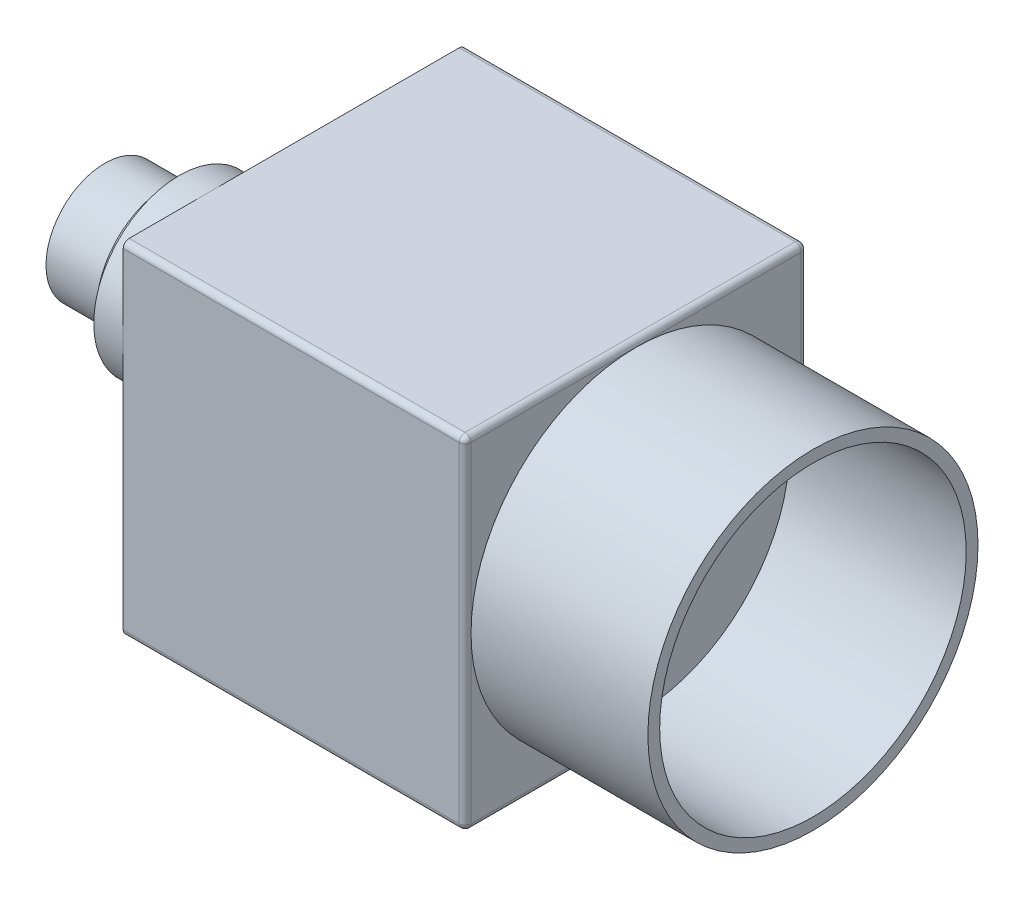
from build123d import *

# Parameters (mm, degrees)
SKETCH_1_W             = 29
SKETCH_1_H             = 29
EXTRUDE_1_DEPTH        = 29
SKETCH_3_W             = 22.7
SKETCH_3_H             = 9
EXTRUDE_3_DEPTH        = 1
SKETCH_4_R             = 1
SKETCH_4_W             = 14
SKETCH_4_H             = 3
SKETCH_4_W_2           = 13
SKETCH_4_H_2           = 2
EXTRUDE_4_DEPTH        = 1
SKETCH_5_R             = 7.25
EXTRUDE_5_DEPTH        = 2.5
SKETCH_6_R             = 6
EXTRUDE_6_DEPTH        = 1
SKETCH_7_R             = 5
EXTRUDE_7_DEPTH        = 5.3
SKETCH_8_R             = 14
SKETCH_8_R_2           = 13
EXTRUDE_8_DEPTH        = 15
HOLE_WIZARD_M3_1_D     = 2.5
HOLE_WIZARD_M3_1_DEPTH = 4.2
HOLE_WIZARD_M3_1_TIP   = 0.751075774
FILLET_1_R             = 0.5


with BuildPart() as part:
    # 草图1 → 凸台-拉伸1 (new body)
    with BuildSketch(Plane(origin=(0, 0, 0), x_dir=(0, 0, -1), z_dir=(1, 0, 0))):
        Rectangle(SKETCH_1_W, SKETCH_1_H)
    extrude(amount=EXTRUDE_1_DEPTH)

    # 草图3 → 凸台-拉伸3 (add)
    with BuildSketch(Plane.ZY):
        with Locations((0, -8.6)):
            Rectangle(SKETCH_3_W, SKETCH_3_H)
    extrude(amount=EXTRUDE_3_DEPTH)

    # 草图4 → 凸台-拉伸4 (add)
    # profile 1 of 3: a face of its own
    with BuildSketch(Plane.ZY.offset(1)):
        with Locations((-9, -8.6)):
            Circle(SKETCH_4_R)
    # profile 2 of 3: a face of its own
    with BuildSketch(Plane.ZY.offset(1)):
        with Locations((9, -8.6)):
            Circle(SKETCH_4_R)
    # profile 3 of 3: a face of its own
    with BuildSketch(Plane.ZY.offset(1)):
        with Locations((0, -8.6)):
            Rectangle(SKETCH_4_W, SKETCH_4_H)
        with Locations((0, -8.6)):
            Rectangle(SKETCH_4_W_2, SKETCH_4_H_2, mode=Mode.SUBTRACT)
    extrude(amount=EXTRUDE_4_DEPTH)

    # 草图5 → 凸台-拉伸5 (add)
    with BuildSketch(Plane.ZY):
        with Locations((7.25, 7.25)):
            Circle(SKETCH_5_R)
    extrude(amount=EXTRUDE_5_DEPTH)

    # 草图6 → 凸台-拉伸6 (add)
    with BuildSketch(Plane.ZY.offset(2.5)):
        with Locations((7.25, 7.25)):
            Circle(SKETCH_6_R)
    extrude(amount=EXTRUDE_6_DEPTH)

    # 草图7 → 凸台-拉伸7 (add)
    with BuildSketch(Plane.ZY.offset(3.5)):
        with Locations((7.25, 7.25)):
            Circle(SKETCH_7_R)
    extrude(amount=EXTRUDE_7_DEPTH)

    # 草图8 → 凸台-拉伸8 (add)
    with BuildSketch(Plane(origin=(29, 0, 0), x_dir=(0, 0, -1), z_dir=(1, 0, 0))):
        with Locations(Location((0, 0, 0), (0, 0, 180))):
            Circle(SKETCH_8_R)
        Circle(SKETCH_8_R_2, mode=Mode.SUBTRACT)
    extrude(amount=EXTRUDE_8_DEPTH)

    # M3 螺纹孔1
    with Locations(Plane(origin=(0, -14.5, 0), x_dir=(-1, 0, 0), z_dir=(0, -1, 0))):
        with Locations((-26.7, 10), (-26.7, -10), (-3, 0)):
            Hole(HOLE_WIZARD_M3_1_D / 2, depth=HOLE_WIZARD_M3_1_DEPTH)
            with Locations((0, 0, -(HOLE_WIZARD_M3_1_DEPTH + HOLE_WIZARD_M3_1_TIP / 2))):  # 118° drill point
                Cone(0, HOLE_WIZARD_M3_1_D / 2, HOLE_WIZARD_M3_1_TIP, mode=Mode.SUBTRACT)

    # 圆角1
    fillet_1_edges = [part.edges().sort_by_distance(p)[0] for p in [
        (29, 0, 14.5),
        (29, -14.5, 0),
        (29, 0, -14.5),
        (29, 14.5, 0),
        (14.5, -14.5, -14.5),
        (14.5, -14.5, 14.5),
        (14.5, 14.5, 14.5),
        (14.5, 14.5, -14.5),
    ]]
    fillet(fillet_1_edges, radius=FILLET_1_R - 0.0001)  # a hair under: the kernel refuses the full size


solid = part.part
